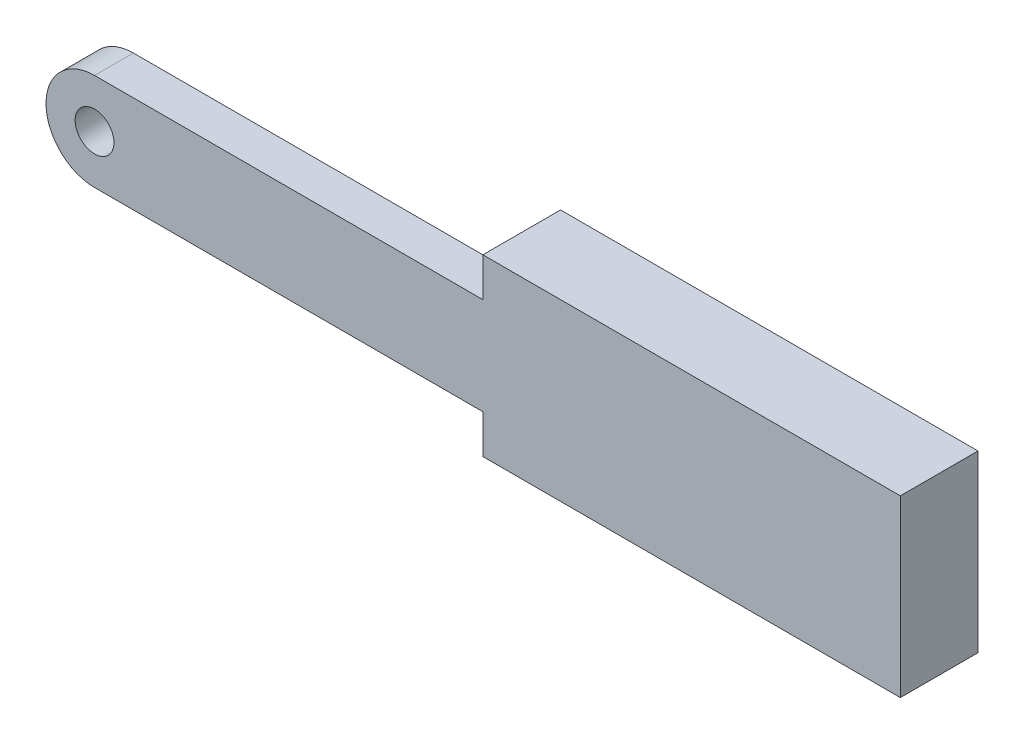
from build123d import *

# Parameters (mm, degrees)
SKETCH1_W           = 43
SKETCH1_H           = 18
BOSS_EXTRUDE1_DEPTH = 8
CAVITY2_DEPTH       = 2.3
BOSS_EXTRUDE2_DEPTH = 4


# Read off the part's stored shape, not the designer's step: Cavity2
with BuildPart() as part:
    # Sketch1 → Boss-Extrude1 (new body)
    with BuildSketch(Plane.XY):
        Rectangle(SKETCH1_W, SKETCH1_H)
    extrude(amount=BOSS_EXTRUDE1_DEPTH)

    # Cavity2 outline → Cavity2 (cut)
    with BuildSketch(Plane.XY):
        with BuildLine():
            ThreePointArc((-4.514897629, -4.536044466), (0, -6.4), (4.514897629, -4.536044466))
            Line((4.514897629, -4.536044466), (17, -2.7))
            ThreePointArc((17, -2.7), (19.7, 0), (17, 2.7))
            Line((17, 2.7), (4.514897629, 4.536044466))
            ThreePointArc((4.514897629, 4.536044466), (0, 6.4), (-4.514897629, 4.536044466))
            Line((-4.514897629, 4.536044466), (-17, 2.7))
            ThreePointArc((-17, 2.7), (-19.7, 0), (-17, -2.7))
            Line((-17, -2.7), (-4.514897629, -4.536044466))
        make_face()
    extrude(amount=CAVITY2_DEPTH, mode=Mode.SUBTRACT)

    # Sketch4 → Boss-Extrude2 (add)
    with BuildSketch(Plane.XY.offset(8)):
        with BuildLine():
            ThreePointArc((-56.5, 0), (-57.964466094, 3.535533906), (-61.5, 5))
            Line((-61.5, 5), (-61.5, 2))
            ThreePointArc((-61.5, 2), (-60.085786438, 1.414213562), (-59.5, 0))
            ThreePointArc((-59.5, 0), (-60.085786438, -1.414213562), (-61.5, -2))
            Line((-61.5, -2), (-61.5, -5))
            ThreePointArc((-61.5, -5), (-57.964466094, -3.535533906), (-56.5, 0))
        make_face()
        with BuildLine():
            Line((-61.5, 2), (-61.5, 5))
            ThreePointArc((-61.5, 5), (-66.5, 0), (-61.5, -5))
            Line((-61.5, -5), (-61.5, -2))
            ThreePointArc((-61.5, -2), (-63.5, 0), (-61.5, 2))
        make_face()
        with BuildLine():
            Line((-21.5, -5), (-21.5, 5))
            Line((-21.5, 5), (-61.5, 5))
            ThreePointArc((-61.5, 5), (-57.964466094, 3.535533906), (-56.5, 0))
            ThreePointArc((-56.5, 0), (-57.964466094, -3.535533906), (-61.5, -5))
            Line((-61.5, -5), (-21.5, -5))
        make_face()
    extrude(amount=-BOSS_EXTRUDE2_DEPTH)


solid = part.part
